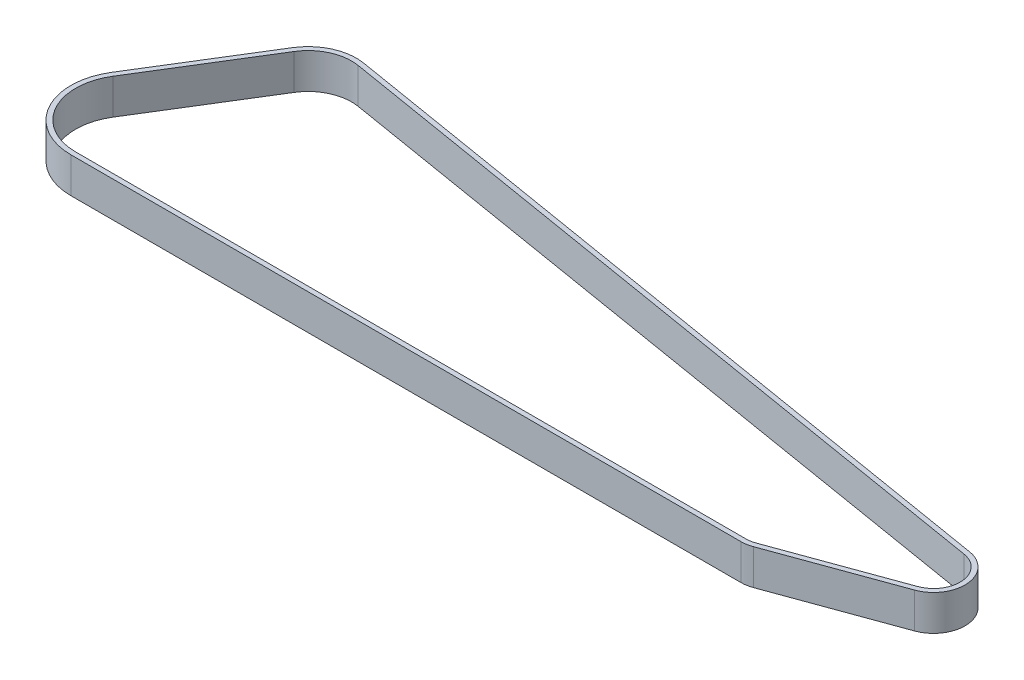
from build123d import *

# Parameters (mm, degrees)
SKETCH_1_W          = 35
SKETCH_1_H          = 55
EXTRUDE_1_DEPTH     = 1
EXTRUDE_2_DEPTH     = 3
SKETCH_3_R          = 5
CUT_EXTRUDE_1_DEPTH = 169.569903897
SKETCH_4_R          = 4
CUT_EXTRUDE_2_DEPTH = 2
SKETCH_5_R          = 2
CUT_EXTRUDE_3_DEPTH = 2
EXTRUDE_START       = 7
EXTRUDE_3_DEPTH     = 7
CUT_EXTRUDE_START   = -1.5
SKETCH_9_W          = 10
SKETCH_9_H          = 26
CUT_EXTRUDE_4_DEPTH = 168.318874833
SKETCH_10_R         = 1.5
CUT_EXTRUDE_5_DEPTH = 194.595583627
EXTRUDE_START_2     = -1
EXTRUDE_9_DEPTH     = 10
SKETCH_15_W         = 494.06035282
SKETCH_15_H         = 240.054640756
CUT_EXTRUDE_6_DEPTH = 10


with BuildPart() as part:
    # 草图1 → 凸台-拉伸1 (new body)
    with BuildSketch(Plane(origin=(0, 0, 0), x_dir=(1, 0, 0), z_dir=(0, 1, 0))):
        Rectangle(SKETCH_1_W, SKETCH_1_H)
    extrude(amount=EXTRUDE_1_DEPTH)

    # 草图2 → 凸台-拉伸2 (add)
    with BuildSketch(Plane(origin=(0, 1, 0), x_dir=(1, 0, 0), z_dir=(0, 1, 0))):
        with BuildLine():
            Line((106.75, -2.25), (106.75, 2.25))
            Line((106.75, 2.25), (121.75, 2.25))
            ThreePointArc((121.75, 2.25), (122.922125199, 2.352547667), (124.058635967, 2.65707481))
            Line((124.058635967, 2.65707481), (154.058635967, 13.576181838))
            ThreePointArc((154.058635967, 13.576181838), (158.397452333, 21.091232227), (151.75, 26.669107028))
            Line((151.75, 26.669107028), (-31.447415548, 57.101298968))
            ThreePointArc((-31.447415548, 57.101298968), (-37.800418235, 56.264673928), (-42.609265279, 52.029632639))
            Line((-42.609265279, 52.029632639), (-60.161792173, 23.605896086))
            ThreePointArc((-60.161792173, 23.605896086), (-61.717833724, 20.073278016), (-62.25, 16.25))
            Line((-62.25, 16.25), (-62.25, -16.25))
            ThreePointArc((-62.25, -16.25), (-61.717833724, -20.073278016), (-60.161792173, -23.605896086))
            Line((-60.161792173, -23.605896086), (-42.609265279, -52.029632639))
            ThreePointArc((-42.609265279, -52.029632639), (-37.800418235, -56.264673928), (-31.447415548, -57.101298968))
            Line((-31.447415548, -57.101298968), (151.75, -26.669107028))
            ThreePointArc((151.75, -26.669107028), (158.397452333, -21.091232227), (154.058635967, -13.576181838))
            Line((154.058635967, -13.576181838), (124.058635967, -2.65707481))
            ThreePointArc((124.058635967, -2.65707481), (122.922125199, -2.352547667), (121.75, -2.25))
            Line((121.75, -2.25), (106.75, -2.25))
        make_face()
    extrude(amount=EXTRUDE_2_DEPTH)

    # 草图3 → 切除-拉伸1 (cut, through all)
    with BuildSketch(Plane(origin=(0, 4, 0), x_dir=(1, 0, 0), z_dir=(0, 1, 0))):
        with Locations((-48.25, 16.25)):
            Circle(SKETCH_3_R)
        with Locations((-48.25, -16.25)):
            Circle(SKETCH_3_R)
    extrude(amount=-CUT_EXTRUDE_1_DEPTH, mode=Mode.SUBTRACT)

    # 草图4 → 切除-拉伸2 (cut)
    with BuildSketch(Plane(origin=(0, 4, 0), x_dir=(1, 0, 0), z_dir=(0, 1, 0))):
        with Locations((-33.25, 46.25)):
            Circle(SKETCH_4_R)
        with Locations((-33.25, -46.25)):
            Circle(SKETCH_4_R)
    extrude(amount=-CUT_EXTRUDE_2_DEPTH, mode=Mode.SUBTRACT)

    # 草图5 → 切除-拉伸3 (cut)
    with BuildSketch(Plane(origin=(0, 4, 0), x_dir=(1, 0, 0), z_dir=(0, 1, 0))):
        with Locations((121.75, 9)):
            Circle(SKETCH_5_R)
        with Locations((121.75, -9)):
            Circle(SKETCH_5_R)
        with Locations((151.75, 19.919107028)):
            Circle(SKETCH_5_R)
        with Locations((151.75, -19.919107028)):
            Circle(SKETCH_5_R)
    extrude(amount=-CUT_EXTRUDE_3_DEPTH, mode=Mode.SUBTRACT)

    # 草图8 → 凸台-拉伸3 (add)
    with BuildSketch(Plane.XZ.offset(-1).offset(EXTRUDE_START)):
        with BuildLine():
            Line((-26.75, -26.25), (-39.75, -26.25))
            Line((-39.75, -26.25), (-39.75, -55.124119675))
            ThreePointArc((-39.75, -55.124119675), (-35.798281322, -56.950759894), (-31.447415548, -57.101298968))
            Line((-31.447415548, -57.101298968), (-26.75, -56.320978726))
            Line((-26.75, -56.320978726), (-26.75, -26.25))
        make_face()
    extrude_3 = extrude(amount=-EXTRUDE_3_DEPTH)

    # 镜向1: 凸台-拉伸3 across plane
    add(extrude_3.mirror(Plane.XY))

    # 草图9 → 切除-拉伸4 (cut, through all)
    with BuildSketch(Plane.XZ.offset(6).offset(CUT_EXTRUDE_START)):
        with Locations((-33.25, -40.75)):
            Rectangle(SKETCH_9_W, SKETCH_9_H)
    cut_extrude_4 = extrude(amount=-CUT_EXTRUDE_4_DEPTH, mode=Mode.SUBTRACT)

    # 镜向2: 切除-拉伸4 across plane
    add(cut_extrude_4.mirror(Plane.XY), mode=Mode.SUBTRACT)

    # 草图10 → 切除-拉伸5 (cut, through all)
    with BuildSketch(Plane.XY.offset(-53.75)):
        with Locations((-33.25, -1.5)):
            Circle(SKETCH_10_R)
    cut_extrude_5 = extrude(amount=-CUT_EXTRUDE_5_DEPTH, mode=Mode.SUBTRACT)

    # 镜向3: 切除-拉伸5 across plane
    add(cut_extrude_5.mirror(Plane.XY), mode=Mode.SUBTRACT)


with BuildPart() as extrude_9_tool:
    # 草图14 → 凸台-拉伸9 (new body)
    with BuildSketch(Plane(origin=(0, 4, 0), x_dir=(1, 0, 0), z_dir=(0, 1, 0)).offset(EXTRUDE_START_2)):
        with BuildLine():
            Line((-31.251746965, 58.315648959), (153.053847851, 27.791868982))
            ThreePointArc((153.053847851, 27.791868982), (159.695906807, 20.655968628), (154.479320744, 12.420359914))
            Line((154.479320744, 12.420359914), (124.479320744, 1.501252886))
            ThreePointArc((124.479320744, 1.501252886), (123.135712458, 1.141234131), (121.75, 1.02))
            Line((121.75, 1.02), (-48.25, 1.02))
            ThreePointArc((-48.25, 1.02), (-61.550861988, 8.8311072), (-61.208328199, 24.2521641))
            Line((-61.208328199, 24.2521641), (-43.655801305, 52.675900653))
            ThreePointArc((-43.655801305, 52.675900653), (-38.311956857, 57.383260653), (-31.251746965, 58.315648959))
        make_face()
        with BuildLine():
            Line((-31.452715995, 57.102178132), (152.852878821, 26.578398154))
            ThreePointArc((152.852878821, 26.578398154), (158.471161773, 20.542392216), (154.058635967, 13.576181838))
            Line((154.058635967, 13.576181838), (124.058635967, 2.65707481))
            ThreePointArc((124.058635967, 2.65707481), (122.922125199, 2.352547667), (121.75, 2.25))
            Line((121.75, 2.25), (-48.25, 2.25))
            ThreePointArc((-48.25, 2.25), (-60.476662366, 9.430269258), (-60.161792173, 23.605896086))
            Line((-60.161792173, 23.605896086), (-42.609265279, 52.029632639))
            ThreePointArc((-42.609265279, 52.029632639), (-37.802863894, 56.263562321), (-31.452715995, 57.102178132))
        make_face(mode=Mode.SUBTRACT)
    extrude(amount=EXTRUDE_9_DEPTH)


with BuildPart() as part_1:
    add(part.part)


with BuildPart() as part_2:
    # 凸台-拉伸9: joined with extrude_9_tool
    add(part_1.part.fuse(extrude_9_tool.part, tol=0.00001))

    # 草图15 → 切除-拉伸6 (cut)
    with BuildSketch(Plane(origin=(0, 4, 0), x_dir=(1, 0, 0), z_dir=(0, 1, 0))):
        with Locations((-36.7841064, 33.929196137)):
            Rectangle(SKETCH_15_W, SKETCH_15_H)
    extrude(amount=-CUT_EXTRUDE_6_DEPTH, mode=Mode.SUBTRACT)


solid = part_2.part
